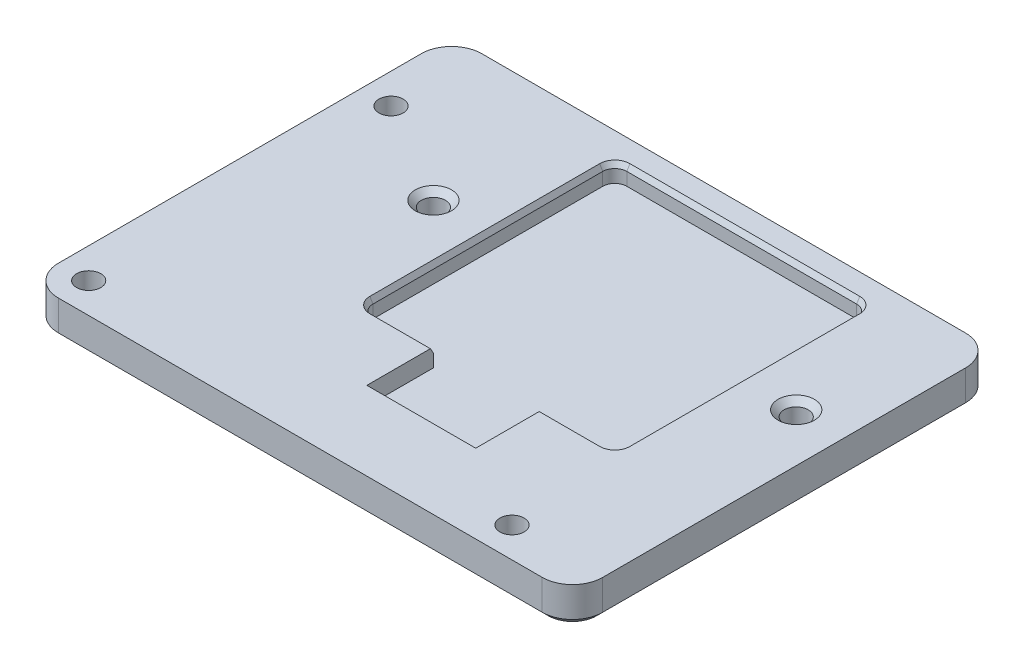
from build123d import *

# Parameters (mm, degrees)
SKETCH_1_W          = 90
SKETCH_1_H          = 70
SKETCH_1_R          = 2
EXTRUDE_1_DEPTH     = 6
FILLET_1_R          = 5
SKETCH_2_W          = 42
SKETCH_2_H          = 42
CUT_EXTRUDE_1_DEPTH = 3
SKETCH_3_W          = 18
SKETCH_3_H          = 18
CUT_EXTRUDE_2_DEPTH = 3
FILLET_2_R          = 2
CHAMFER_1_SIZE      = 2
SKETCH_4_R          = 2
CUT_EXTRUDE_3_DEPTH = 5
CHAMFER_2_SIZE      = 1
CHAMFER_3_SIZE      = 1
CHAMFER_4_SIZE      = 0.5
CHAMFER_4_SIZE2     = 0.866025404


with BuildPart() as part:
    # Эскиз1 → Бобышка-Вытянуть1 (new body)
    with BuildSketch(Plane(origin=(0, 0, 0), x_dir=(1, 0, 0), z_dir=(0, 1, 0))):
        with Locations((5, 5)):
            Rectangle(SKETCH_1_W, SKETCH_1_H)
        with Locations((-35, -25)):
            Circle(SKETCH_1_R, mode=Mode.SUBTRACT)
        with Locations((35, -25)):
            Circle(SKETCH_1_R, mode=Mode.SUBTRACT)
        with Locations((-35, 25)):
            Circle(SKETCH_1_R, mode=Mode.SUBTRACT)
    extrude(amount=EXTRUDE_1_DEPTH)

    # Скругление1
    fillet_1_edges = [part.edges().sort_by_distance(p)[0] for p in [
        (-40, 3, -40),
        (50, 3, -40),
        (50, 3, 30),
        (-40, 3, 30),
    ]]
    fillet(fillet_1_edges, radius=FILLET_1_R)

    # Эскиз2 → Вырез-Вытянуть1 (cut)
    with BuildSketch(Plane(origin=(0, 6, 0), x_dir=(1, 0, 0), z_dir=(0, 1, 0))):
        with Locations((12, 15)):
            Rectangle(SKETCH_2_W, SKETCH_2_H)
    extrude(amount=-CUT_EXTRUDE_1_DEPTH, mode=Mode.SUBTRACT)

    # Эскиз3 → Вырез-Вытянуть2 (cut)
    with BuildSketch(Plane(origin=(0, 6, 0), x_dir=(1, 0, 0), z_dir=(0, 1, 0))):
        with Locations((12, -6)):
            Rectangle(SKETCH_3_W, SKETCH_3_H)
    extrude(amount=-CUT_EXTRUDE_2_DEPTH, mode=Mode.SUBTRACT)

    # Скругление2
    fillet_2_edges = [part.edges().sort_by_distance(p)[0] for p in [
        (33, 4.5, 6),
        (-9, 4.5, 6),
        (-9, 4.5, -36),
        (33, 4.5, -36),
    ]]
    fillet(fillet_2_edges, radius=FILLET_2_R)

    # Фаска1
    chamfer_1_edges = [part.edges().sort_by_distance(p)[0] for p in [
        (12, 6, 15),
    ]]
    chamfer(chamfer_1_edges, length=CHAMFER_1_SIZE)

    # Эскиз4 → Вырез-Вытянуть3 (cut)
    with BuildSketch(Plane(origin=(0, 6, 0), x_dir=(1, 0, 0), z_dir=(0, 1, 0))):
        with Locations((-18, 15)):
            Circle(SKETCH_4_R)
        with Locations((42, 15)):
            Circle(SKETCH_4_R)
    extrude(amount=-CUT_EXTRUDE_3_DEPTH, mode=Mode.SUBTRACT)

    # Фаска2
    chamfer_2_edges = [part.edges().sort_by_distance(p)[0] for p in [
        (40, 6, -15),
        (-20, 6, -15),
    ]]
    chamfer(chamfer_2_edges, length=CHAMFER_2_SIZE)

    # Фаска3
    chamfer_3_edges = [part.edges().sort_by_distance(p)[0] for p in [
        (-38.535533906, 0, 28.535533906),
        (5, 0, 30),
        (48.535533906, 0, 28.535533906),
        (50, 0, -5),
        (48.535533906, 0, -38.535533906),
        (5, 0, -40),
        (-38.535533906, 0, -38.535533906),
        (-40, 0, -5),
        (-37, 0, -25),
        (-37, 0, 25),
        (33, 0, 25),
    ]]
    chamfer(chamfer_3_edges, length=CHAMFER_3_SIZE)

    # Фаска4
    chamfer_4_edges = [part.edges().sort_by_distance(p)[0] for p in [
        (26, 6, 6),
        (32.414213562, 6, 5.414213562),
        (33, 6, -15),
        (32.414213562, 6, -35.414213562),
        (12, 6, -36),
        (-2, 6, 6),
        (-8.414213562, 6, -35.414213562),
        (-8.414213562, 6, 5.414213562),
        (-9, 6, -15),
    ]]
    chamfer_4_side = [part.faces().sort_by_distance(p)[0] for p in [
        (37.859824575, 6, -15),
    ]]
    chamfer(chamfer_4_edges, length=CHAMFER_4_SIZE, length2=CHAMFER_4_SIZE2, reference=chamfer_4_side[0])


solid = part.part
